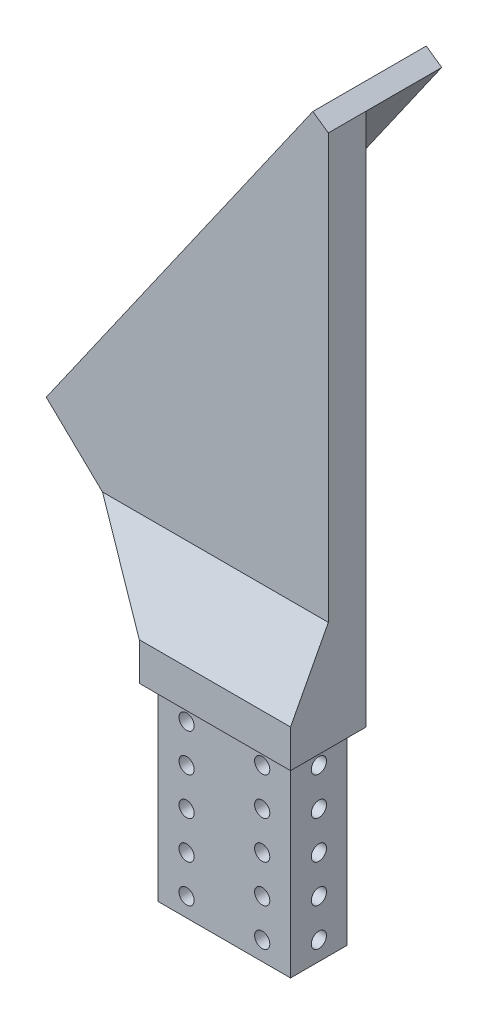
from build123d import *

# Parameters (mm, degrees)
BOSS_EXTRUDE1_DEPTH = 25.4
SKETCH3_W           = 50.8
SKETCH3_H           = 63.5
CUT_EXTRUDE1_DEPTH  = 3.175
SKETCH4_W           = 25.4
SKETCH4_H           = 63.5
CUT_EXTRUDE2_DEPTH  = 3.175
SKETCH5_W           = 50.8
SKETCH5_H           = 63.5
CUT_EXTRUDE3_DEPTH  = 3.175
SKETCH6_W           = 25.4
SKETCH6_H           = 63.5
CUT_EXTRUDE4_DEPTH  = 3.175
SKETCH7_W           = 101.6
SKETCH7_H           = 177.8
CUT_EXTRUDE5_DEPTH  = 298.299377732
CUT_EXTRUDE7_DEPTH  = 275.74300719
CUT_EXTRUDE6_DEPTH  = 275.74300719
CUT_EXTRUDE8_DEPTH  = 271.614582269
SKETCH11_R          = 2.5527
CUT_EXTRUDE9_DEPTH  = 259.040032264
SKETCH12_R          = 2.5527
CUT_EXTRUDE10_DEPTH = 260.254504648
BOSS_EXTRUDE2_DEPTH = 25.4
CUT_EXTRUDE11_DEPTH = 263.236499242
CUT_EXTRUDE12_DEPTH = 263.052184929
CUT_EXTRUDE13_DEPTH = 266.160848634


with BuildPart() as part:
    # Sketch1 → Boss-Extrude1 (new body)
    with BuildSketch(Plane.XY):
        Polygon((50.8, 76.2), (152.4, 76.2), (152.4, 254), (-101.6, 254), (-101.6, 76.2), (0, 76.2), (0, 0), (50.8, 0), align=None)
    extrude(amount=BOSS_EXTRUDE1_DEPTH)

    # Sketch3 → Cut-Extrude1 (cut)
    with BuildSketch(Plane.XY.offset(25.4)):
        with Locations((25.4, 31.75)):
            Rectangle(SKETCH3_W, SKETCH3_H)
    extrude(amount=-CUT_EXTRUDE1_DEPTH, mode=Mode.SUBTRACT)

    # Sketch4 → Cut-Extrude2 (cut)
    with BuildSketch(Plane.ZY):
        with Locations((12.7, 31.75)):
            Rectangle(SKETCH4_W, SKETCH4_H)
    extrude(amount=-CUT_EXTRUDE2_DEPTH, mode=Mode.SUBTRACT)

    # Sketch5 → Cut-Extrude3 (cut)
    with BuildSketch(Plane(origin=(0, 0, 0), x_dir=(-1, 0, 0), z_dir=(0, 0, -1))):
        with Locations((-25.4, 31.75)):
            Rectangle(SKETCH5_W, SKETCH5_H)
    extrude(amount=-CUT_EXTRUDE3_DEPTH, mode=Mode.SUBTRACT)

    # Sketch6 → Cut-Extrude4 (cut)
    with BuildSketch(Plane(origin=(50.8, 0, 0), x_dir=(0, 0, -1), z_dir=(1, 0, 0))):
        with Locations((-12.7, 31.75)):
            Rectangle(SKETCH6_W, SKETCH6_H)
    extrude(amount=-CUT_EXTRUDE4_DEPTH, mode=Mode.SUBTRACT)

    # Sketch7 → Cut-Extrude5 (cut, through all)
    with BuildSketch(Plane.XY.offset(25.4)):
        with Locations((101.6, 165.1)):
            Rectangle(SKETCH7_W, SKETCH7_H)
    extrude(amount=-CUT_EXTRUDE5_DEPTH, mode=Mode.SUBTRACT)

    # Sketch9 → Cut-Extrude7 (cut, through all)
    with BuildSketch(Plane.XY.offset(25.4)):
        Polygon((34.65764308, 254), (50.8, 254), (50.8, 242.697), align=None)
    extrude(amount=-CUT_EXTRUDE7_DEPTH, mode=Mode.SUBTRACT)

    # Sketch8 → Cut-Extrude6 (cut, through all)
    with BuildSketch(Plane.XY.offset(25.4)):
        Polygon((34.65764308, 254), (-101.6, 59.403918632), (-101.6, 254), align=None)
    extrude(amount=-CUT_EXTRUDE6_DEPTH, mode=Mode.SUBTRACT)

    # Sketch10 → Cut-Extrude8 (cut, through all)
    with BuildSketch(Plane.XY.offset(25.4)):
        Polygon((34.65764308, 254), (45.59768076, 246.339703148), (-84.029822158, 61.212443237), (-94.969859838, 68.872740089), align=None)
    extrude(amount=-CUT_EXTRUDE8_DEPTH, mode=Mode.SUBTRACT)

    # Sketch11 → Cut-Extrude9 (cut, through all)
    with BuildSketch(Plane.XY.offset(22.225)):
        with Locations((12.7, 57.15)):
            Circle(SKETCH11_R)
        with Locations((12.7, 44.45)):
            Circle(SKETCH11_R)
        with Locations((12.7, 31.75)):
            Circle(SKETCH11_R)
        with Locations((12.7, 19.05)):
            Circle(SKETCH11_R)
        with Locations((12.7, 6.35)):
            Circle(SKETCH11_R)
        with Locations((38.1, 44.45)):
            Circle(SKETCH11_R)
        with Locations((38.1, 31.75)):
            Circle(SKETCH11_R)
        with Locations((38.1, 19.05)):
            Circle(SKETCH11_R)
        with Locations((38.1, 6.35)):
            Circle(SKETCH11_R)
        with Locations((38.1, 57.15)):
            Circle(SKETCH11_R)
    extrude(amount=-CUT_EXTRUDE9_DEPTH, mode=Mode.SUBTRACT)

    # Sketch12 → Cut-Extrude10 (cut, through all)
    with BuildSketch(Plane.ZY.offset(-3.175)):
        with Locations((12.7, 57.15)):
            Circle(SKETCH12_R)
        with Locations((12.7, 44.45)):
            Circle(SKETCH12_R)
        with Locations((12.7, 31.75)):
            Circle(SKETCH12_R)
        with Locations((12.7, 19.05)):
            Circle(SKETCH12_R)
        with Locations((12.7, 6.35)):
            Circle(SKETCH12_R)
    extrude(amount=-CUT_EXTRUDE10_DEPTH, mode=Mode.SUBTRACT)

    # Sketch17 → Boss-Extrude2 (add)
    with BuildSketch(Plane(origin=(0, 0, 0), x_dir=(-1, 0, 0), z_dir=(0, 0, -1))):
        Polygon((-45.59768076, 246.339703148), (-50.799296241, 242.697492777), (68.987953783, 71.623570423), (74.189569264, 75.265780794), align=None)
    extrude(amount=BOSS_EXTRUDE2_DEPTH)

    # Sketch18 → Cut-Extrude11 (cut, through all)
    with BuildSketch(Plane(origin=(0, 0, -25.4), x_dir=(-1, 0, 0), z_dir=(0, 0, -1))):
        Polygon((65.783503294, 76.2), (73.535421933, 76.2), (74.189569264, 75.265780794), (68.987953783, 71.623570423), align=None)
    extrude(amount=-CUT_EXTRUDE11_DEPTH, mode=Mode.SUBTRACT)

    # Sketch19 → Cut-Extrude12 (cut, through all)
    with BuildSketch(Plane.XY.offset(25.4)):
        Polygon((0, 76.2), (-43.972708631, 118.419930077), (-73.535421933, 76.2), align=None)
    extrude(amount=-CUT_EXTRUDE12_DEPTH, mode=Mode.SUBTRACT)

    # Sketch20 → Cut-Extrude13 (cut, through all)
    with BuildSketch(Plane(origin=(50.8, 0, 0), x_dir=(0, 0, -1), z_dir=(1, 0, 0))):
        Polygon((-25.4, 76.2), (-12.7, 100.289703148), (-12.7, 246.339703148), (-25.4, 246.339703148), align=None)
    extrude(amount=-CUT_EXTRUDE13_DEPTH, mode=Mode.SUBTRACT)


solid = part.part
